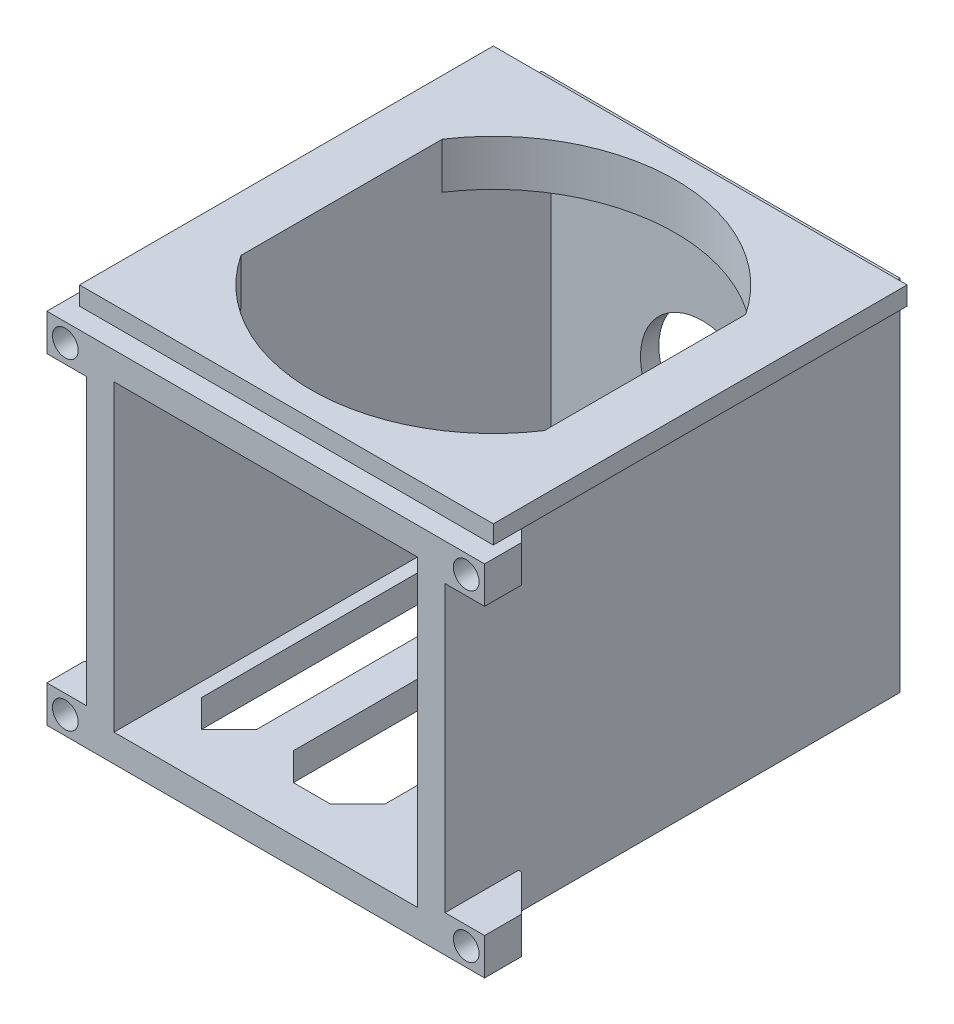
from build123d import *

# Parameters (mm, degrees)
CROQUIS1_W               = 39
CROQUIS1_H               = 39
SALIENTE_EXTRUIR2_DEPTH  = 75.5
CROQUIS2_W               = 33
CROQUIS2_H               = 33
CORTAR_EXTRUIR1_DEPTH    = 80
CROQUIS11_W              = 33
CROQUIS11_H              = 33
SALIENTE_EXTRUIR3_DEPTH  = 37
CROQUIS13_W              = 33
CROQUIS13_H              = 33
CORTAR_EXTRUIR6_DEPTH    = 81.378790735
CROQUIS16_W              = 39
CROQUIS16_H              = 39
CORTAR_EXTRUIR8_DEPTH    = 10
CROQUIS19_W              = 20
CROQUIS19_H              = 20
SALIENTE_EXTRUIR4_DEPTH  = 3
CROQUIS33_W              = 39
CROQUIS33_H              = 39
SALIENTE_EXTRUIR7_DEPTH  = 18
CROQUIS35_W              = 39
CROQUIS35_H              = 39
CORTAR_EXTRUIR17_DEPTH   = 16
CROQUIS36_R              = 6.75
CORTAR_EXTRUIR18_DEPTH   = 2
CORTAR_EXTRUIR19_REACH   = 89.187
SALIENTE_EXTRUIR10_START = 2
CROQUIS38_W              = 45
CROQUIS38_H              = 45
SALIENTE_EXTRUIR10_DEPTH = 2
CROQUIS39_W              = 7.3
CROQUIS39_H              = 4
SALIENTE_EXTRUIR12_DEPTH = 8
RESPIRADERO1_START       = 31
RESPIRADERO1_OUTLINE_W   = 6
RESPIRADERO1_OUTLINE_H   = 3
RESPIRADERO1_OUTLINE_W_2 = 10
RESPIRADERO1_DEPTH       = 39.5
CHAFL_N7_SIZE            = 3
CROQUIS40_R              = 1.4
CORTAR_EXTRUIR20_DEPTH   = 10
CHAFL_N8_SIZE            = 4
CORTAR_EXTRUIR21_REACH   = 60.983
CROQUIS43_R              = 1.5


# Read off the part's stored shape, not the designer's step: Respiradero1
# Some blends are built 0.0001 mm under size
with BuildPart() as part:
    # Croquis1 → Saliente-Extruir2 (new body)
    with BuildSketch(Plane.XY):
        Rectangle(CROQUIS1_W, CROQUIS1_H)
    extrude(amount=SALIENTE_EXTRUIR2_DEPTH)

    # Croquis2 → Cortar-Extruir1 (cut)
    with BuildSketch(Plane.XY.offset(75.5)):
        Rectangle(CROQUIS2_W, CROQUIS2_H)
    extrude(amount=-CORTAR_EXTRUIR1_DEPTH, mode=Mode.SUBTRACT)

    # Croquis11 → Saliente-Extruir3 (add)
    with BuildSketch(Plane(origin=(0, 0, 0), x_dir=(-1, 0, 0), z_dir=(0, 0, -1))):
        Rectangle(CROQUIS11_W, CROQUIS11_H)
    extrude(amount=-SALIENTE_EXTRUIR3_DEPTH)

    # Croquis13 → Cortar-Extruir6 (cut, through all)
    with BuildSketch(Plane(origin=(0, 0, 0), x_dir=(-1, 0, 0), z_dir=(0, 0, -1))):
        Rectangle(CROQUIS13_W, CROQUIS13_H)
    extrude(amount=-CORTAR_EXTRUIR6_DEPTH, mode=Mode.SUBTRACT)

    # Croquis16 → Cortar-Extruir8 (cut)
    with BuildSketch(Plane(origin=(0, 0, 0), x_dir=(-1, 0, 0), z_dir=(0, 0, -1))):
        Rectangle(CROQUIS16_W, CROQUIS16_H)
    extrude(amount=-CORTAR_EXTRUIR8_DEPTH, mode=Mode.SUBTRACT)

    # Croquis19 → Saliente-Extruir4 (add)
    with BuildSketch(Plane(origin=(0, 19.5, 0), x_dir=(1, 0, 0), z_dir=(0, 1, 0))):
        with Locations((-2, -55.5)):
            Rectangle(CROQUIS19_W, CROQUIS19_H)
    extrude(amount=-SALIENTE_EXTRUIR4_DEPTH)

    # Croquis33 → Saliente-Extruir7 (add)
    with BuildSketch(Plane(origin=(0, 0, 10), x_dir=(-1, 0, 0), z_dir=(0, 0, -1))):
        Rectangle(CROQUIS33_W, CROQUIS33_H)
    extrude(amount=-SALIENTE_EXTRUIR7_DEPTH)

    # Croquis35 → Cortar-Extruir17 (cut)
    with BuildSketch(Plane(origin=(0, 0, 10), x_dir=(-1, 0, 0), z_dir=(0, 0, -1))):
        Rectangle(CROQUIS35_W, CROQUIS35_H)
    extrude(amount=-CORTAR_EXTRUIR17_DEPTH, mode=Mode.SUBTRACT)

    # Croquis36 → Cortar-Extruir18 (cut)
    with BuildSketch(Plane(origin=(0, 0, 26), x_dir=(-1, 0, 0), z_dir=(0, 0, -1))):
        Circle(CROQUIS36_R)
    extrude(amount=-CORTAR_EXTRUIR18_DEPTH, mode=Mode.SUBTRACT)

    # Croquis37 → Cortar-Extruir19 (cut, up to next)
    with BuildSketch(Plane(origin=(0, 19.5, 0), x_dir=(1, 0, 0), z_dir=(0, 1, 0)), mode=Mode.PRIVATE) as cortar_extruir19_sk1:
        with BuildLine():
            ThreePointArc((-5.8e-08, -30.95), (-6.484436966, -32.041924812), (-12.253670087, -35.19726489))
            Line((-12.253670087, -35.19726489), (12.253670087, -66.30273511))
            ThreePointArc((12.253670087, -66.30273511), (14.560271631, -64.167842228), (16.5, -61.694861808))
            Line((16.5, -61.694861808), (16.5, -39.805138192))
            ThreePointArc((16.5, -39.805138192), (9.363005266, -33.303678543), (-5.8e-08, -30.95))
        make_face()
    cortar_extruir19_tool1 = extrude(cortar_extruir19_sk1.sketch, amount=-CORTAR_EXTRUIR19_REACH, mode=Mode.PRIVATE) & part.part
    # Croquis37 → Cortar-Extruir19 (cut, up to next)
    with BuildSketch(Plane(origin=(0, 19.5, 0), x_dir=(1, 0, 0), z_dir=(0, 1, 0)), mode=Mode.PRIVATE) as cortar_extruir19_sk2:
        with BuildLine():
            Line((12.253670087, -66.30273511), (-12.253670087, -35.19726489))
            ThreePointArc((-12.253670087, -35.19726489), (-14.560271631, -37.332157772), (-16.5, -39.805138192))
            Line((-16.5, -39.805138192), (-16.5, -61.694861808))
            ThreePointArc((-16.5, -61.694861808), (-9.363005292, -68.196321443), (0, -70.55))
            ThreePointArc((0, -70.55), (6.484436939, -69.458075197), (12.253670087, -66.30273511))
        make_face()
    cortar_extruir19_tool2 = extrude(cortar_extruir19_sk2.sketch, amount=-CORTAR_EXTRUIR19_REACH, mode=Mode.PRIVATE) & part.part
    add(cortar_extruir19_tool1.solids().sort_by_distance((5.629579, 19.5, 45.099579))[0], mode=Mode.SUBTRACT)
    add(cortar_extruir19_tool2.solids().sort_by_distance((-5.629579, 19.5, 56.400421))[0], mode=Mode.SUBTRACT)

    # Croquis38 → Saliente-Extruir10 (add)
    with BuildSketch(Plane(origin=(0, 19.5, 0), x_dir=(1, 0, 0), z_dir=(0, 1, 0)).offset(SALIENTE_EXTRUIR10_START)):
        with Locations((0, -50.75)):
            Rectangle(CROQUIS38_W, CROQUIS38_H)
        with BuildLine():
            Line((-16.5, -39.805138192), (-16.5, -61.694861808))
            ThreePointArc((-16.5, -61.694861808), (0, -70.55), (16.5, -61.694861808))
            Line((16.5, -61.694861808), (16.5, -39.805138192))
            ThreePointArc((16.5, -39.805138192), (0, -30.95), (-16.5, -39.805138192))
        make_face(mode=Mode.SUBTRACT)
    extrude(amount=-SALIENTE_EXTRUIR10_DEPTH)

    # Croquis39 → Saliente-Extruir12 (add)
    with BuildSketch(Plane.XY.offset(75.5)):
        Polygon((-16.5, 16.5), (-16.5, 19.5), (-23.8, 19.5), (-23.8, 15.5), (-16.5, 15.5), align=None)
        with Locations((-20.15, -17.5)):
            Rectangle(CROQUIS39_W, CROQUIS39_H)
        with Locations((20.15, -17.5)):
            Rectangle(CROQUIS39_W, CROQUIS39_H)
        with Locations((20.15, 17.5)):
            Rectangle(CROQUIS39_W, CROQUIS39_H)
    extrude(amount=-SALIENTE_EXTRUIR12_DEPTH)

    # Respiradero1 outline → Respiradero1 (cut)
    with BuildSketch(Plane.XY.offset(RESPIRADERO1_START)):
        with Locations((-12, -18)):
            Rectangle(RESPIRADERO1_OUTLINE_W, RESPIRADERO1_OUTLINE_H)
        with Locations((0, -18)):
            Rectangle(RESPIRADERO1_OUTLINE_W_2, RESPIRADERO1_OUTLINE_H)
        with Locations((12, -18)):
            Rectangle(RESPIRADERO1_OUTLINE_W, RESPIRADERO1_OUTLINE_H)
    extrude(amount=RESPIRADERO1_DEPTH, mode=Mode.SUBTRACT)

    # Chaflán7
    chafl_n7_edges = [part.edges().sort_by_distance(p)[0] for p in [
        (15, -18, 70.5),
        (-15, -18, 70.5),
        (-15, -18, 31),
        (15, -18, 31),
        (5, -18, 31),
        (5, -18, 70.5),
        (9, -18, 70.5),
        (9, -18, 31),
        (-5, -18, 70.5),
        (-5, -18, 31),
        (-9, -18, 31),
        (-9, -18, 70.5),
    ]]
    chamfer(chafl_n7_edges, length=CHAFL_N7_SIZE - 0.0001)  # a hair under: the kernel refuses the full size

    # Croquis40 → Cortar-Extruir20 (cut)
    with BuildSketch(Plane.XY.offset(75.5)):
        with Locations((-21.8, 17.5)):
            Circle(CROQUIS40_R)
        with Locations((21.8, 17.5)):
            Circle(CROQUIS40_R)
        with Locations((21.8, -17.5)):
            Circle(CROQUIS40_R)
        with Locations((-21.8, -17.5)):
            Circle(CROQUIS40_R)
    extrude(amount=-CORTAR_EXTRUIR20_DEPTH, mode=Mode.SUBTRACT)

    # Chaflán8
    # the kernel refuses this chamfer: 4 mm, written as the material it takes off along each edge
    with BuildSketch(Plane(origin=(-23.8, 19.5, 67.5), x_dir=(-0.02749587661058651, 0, 0.9996219169112968), z_dir=(0, -1, 0)), Plane(origin=(23.8, 5.213268048, 67.5), x_dir=(0.02749587661058651, 0, 0.9996219169112968), z_dir=(0, 1, 0))) as chafl_n8_piece_1:
        Polygon((CHAFL_N8_SIZE * 0.999621916911, -CHAFL_N8_SIZE * 0.0274958766106), (-CHAFL_N8_SIZE * 0.0274958766106, -CHAFL_N8_SIZE * 0.999621916911), (0, 0), align=None)
    extrude(amount=14.286731952, mode=Mode.SUBTRACT)
    with BuildSketch(Plane(origin=(-23.8, -29.786731952, 67.5), x_dir=(-0.02749587661058651, 0, 0.9996219169112968), z_dir=(0, 1, 0))) as chafl_n8_piece_2:
        Polygon((CHAFL_N8_SIZE * 0.999621916911, CHAFL_N8_SIZE * 0.0274958766106), (-CHAFL_N8_SIZE * 0.0274958766106, CHAFL_N8_SIZE * 0.999621916911), (0, 0), align=None)
    extrude(amount=24.573463904, mode=Mode.SUBTRACT)
    with BuildSketch(Plane(origin=(23.8, -29.786731952, 67.5), x_dir=(0.02749587661058651, 0, 0.9996219169112968), z_dir=(0, 1, 0))) as chafl_n8_piece_3:
        Polygon((CHAFL_N8_SIZE * 0.999621916911, -CHAFL_N8_SIZE * 0.0274958766106), (-CHAFL_N8_SIZE * 0.0274958766106, -CHAFL_N8_SIZE * 0.999621916911), (0, 0), align=None)
    extrude(amount=24.573463904, mode=Mode.SUBTRACT)

    # Croquis43 → Cortar-Extruir21 (cut, up to next)
    with BuildSketch(Plane(origin=(0, 0, 26), x_dir=(-1, 0, 0), z_dir=(0, 0, -1)), mode=Mode.PRIVATE) as cortar_extruir21_sk1:
        with Locations((10, -10)):
            Circle(CROQUIS43_R)
    cortar_extruir21_tool1 = extrude(cortar_extruir21_sk1.sketch, amount=-CORTAR_EXTRUIR21_REACH, mode=Mode.PRIVATE) & part.part
    add(cortar_extruir21_tool1.solids().sort_by_distance((-10, -10, 26))[0], mode=Mode.SUBTRACT)


solid = part.part
